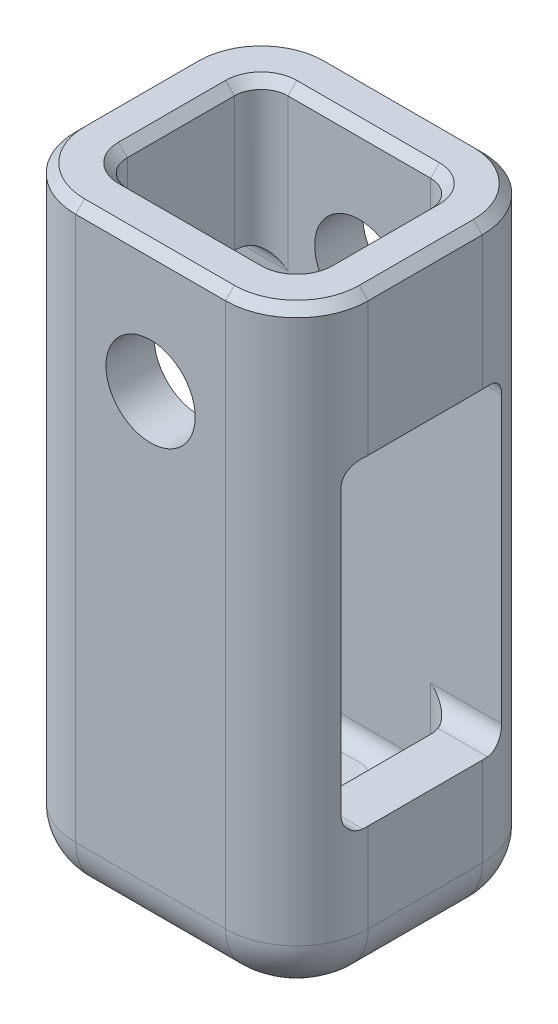
from build123d import *

# Parameters (mm, degrees)
SKETCH1_W                 = 8.2
SKETCH1_H                 = 7.2
BOSS_EXTRUDE1_DEPTH       = 8.5
SKETCH2_W                 = 0.25
SKETCH2_H                 = 0.25
SKETCH2_H_2               = 4
SKETCH2_W_2               = 5
CHAIN_DEPTH               = 15
F_2_5_MM_DOWEL_DEPTH      = 11.100495037
F_2_5_MM_DOWEL_DEPTH_BACK = 11.100495037
SKETCH3_R                 = 1.25
SKETCH4_R                 = 0.9
STEEL_CABLE_CHANNEL_DEPTH = 11.100495037
CRIMP_WINDOW_DEPTH        = 11.100495037
CRIMP_WINDOW_DEPTH_BACK   = 11.100495037
SKETCH7_W                 = 4.5
SKETCH7_H                 = 9
FILLET6_R                 = 0.75
FILLET7_R                 = 0.5
FILLET9_R                 = 0.5
FILLET3_R                 = 2
FILLET5_R                 = 1.5
CHAMFER1_SIZE             = 0.25
BOSS_EXTRUDE2_START       = 0.005
SKETCH5_R                 = 1.9
SKETCH5_R_2               = 0.9
BOSS_EXTRUDE2_DEPTH       = 0.005


with BuildPart() as part:
    # Sketch1 → Boss-Extrude1 (new, symmetric)
    with BuildSketch(Plane(origin=(0, 0, 0), x_dir=(1, 0, 0), z_dir=(0, 1, 0))):
        Rectangle(SKETCH1_W, SKETCH1_H)
    extrude(amount=BOSS_EXTRUDE1_DEPTH, both=True)

    # Sketch2 → chain (cut)
    with BuildSketch(Plane(origin=(0, 8.5, 0), x_dir=(1, 0, 0), z_dir=(0, 1, 0))):
        with Locations((-2.625, 2.125)):
            Rectangle(SKETCH2_W, SKETCH2_H)
        with Locations((-2.625, 0)):
            Rectangle(SKETCH2_W, SKETCH2_H_2)
        with Locations((0, 2.125)):
            Rectangle(SKETCH2_W_2, SKETCH2_H)
        Rectangle(SKETCH2_W_2, SKETCH2_H_2)
        with Locations((2.625, 2.125)):
            Rectangle(SKETCH2_W, SKETCH2_H)
        with Locations((2.625, 0)):
            Rectangle(SKETCH2_W, SKETCH2_H_2)
        with Locations((2.625, -2.125)):
            Rectangle(SKETCH2_W, SKETCH2_H)
        with Locations((0, -2.125)):
            Rectangle(SKETCH2_W_2, SKETCH2_H)
        with Locations((-2.625, -2.125)):
            Rectangle(SKETCH2_W, SKETCH2_H)
    extrude(amount=-CHAIN_DEPTH, mode=Mode.SUBTRACT)

    # Sketch3 → 2.5 mm dowel (cut, two sides: drawn at the far end of the back side and taken through both)
    with BuildSketch(Plane.XY.offset(-F_2_5_MM_DOWEL_DEPTH_BACK)):
        with Locations((0, 5)):
            Circle(SKETCH3_R)
    extrude(amount=F_2_5_MM_DOWEL_DEPTH + F_2_5_MM_DOWEL_DEPTH_BACK, mode=Mode.SUBTRACT)

    # Sketch4 → steel cable channel (cut, through all)
    with BuildSketch(Plane(origin=(0, 0, 0), x_dir=(1, 0, 0), z_dir=(0, 1, 0))):
        with Locations(Location((0, 0, 0), (0, 0, 270))):
            Circle(SKETCH4_R)
    extrude(amount=-STEEL_CABLE_CHANNEL_DEPTH, mode=Mode.SUBTRACT)

    # Sketch7 → crimp window (cut, two sides: drawn at the far end of the back side and taken through both)
    with BuildSketch(Plane.ZY.offset(-CRIMP_WINDOW_DEPTH_BACK)):
        Rectangle(SKETCH7_W, SKETCH7_H)
    extrude(amount=CRIMP_WINDOW_DEPTH + CRIMP_WINDOW_DEPTH_BACK, mode=Mode.SUBTRACT)

    # Fillet6
    fillet6_edges = [part.edges().sort_by_distance(p)[0] for p in [
        (-2.75, -5.5, -2.25),
        (2.75, -5.5, -2.25),
        (2.75, -5.5, 2.25),
        (-2.75, -5.5, 2.25),
        (-2.75, 6.5, -2.25),
        (-2.75, 6.5, 2.25),
        (2.75, 6.5, 2.25),
        (2.75, 6.5, -2.25),
    ]]
    fillet(fillet6_edges, radius=FILLET6_R)

    # Fillet7
    fillet7_edges = [part.edges().sort_by_distance(p)[0] for p in [
        (2.75, -6.5, 0),
        (2.530330086, -6.5, -2.030330086),
        (2.530330086, -6.5, 2.030330086),
        (-2.530330086, -6.5, 2.030330086),
        (-2.530330086, -6.5, -2.030330086),
        (0, -6.5, -2.25),
        (0, -6.5, 2.25),
        (-2.75, -6.5, 0),
    ]]
    fillet(fillet7_edges, radius=FILLET7_R)

    # Fillet9
    fillet9_edges = [part.edges().sort_by_distance(p)[0] for p in [
        (3.05, 4.5, -2.25),
        (3.05, -4.5, 2.25),
        (3.05, 4.5, 2.25),
        (-3.05, 4.5, 2.25),
        (3.05, -4.5, -2.25),
        (-3.05, -4.5, -2.25),
        (-3.05, 4.5, -2.25),
        (-3.05, -4.5, 2.25),
    ]]
    fillet(fillet9_edges, radius=FILLET9_R)

    # Fillet3
    # the kernel refuses this fillet: 2 mm, written as the material it takes off along each edge
    with BuildSketch(Plane(origin=(-4.1, 13.5, -3.6), x_dir=(1, 0, 0), z_dir=(0, -1, 0)), Plane(origin=(4.1, -13.5, -3.6), x_dir=(-1, 0, 0), z_dir=(0, 1, 0))) as fillet3_piece_1:
        with BuildLine():
            CenterArc((FILLET3_R, FILLET3_R), FILLET3_R, 180, 90)
            Line((0, FILLET3_R), (0, 0))
            Line((0, 0), (FILLET3_R, 0))
        make_face()
    extrude(amount=27, mode=Mode.SUBTRACT)
    with BuildSketch(Plane(origin=(-4.1, 13.5, 3.6), x_dir=(1, 0, 0), z_dir=(0, -1, 0)), Plane(origin=(4.1, -13.5, 3.6), x_dir=(-1, 0, 0), z_dir=(0, 1, 0))) as fillet3_piece_2:
        with BuildLine():
            CenterArc((FILLET3_R, -FILLET3_R), FILLET3_R, 90, 90)
            Line((0, -FILLET3_R), (0, 0))
            Line((0, 0), (FILLET3_R, 0))
        make_face()
    extrude(amount=27, mode=Mode.SUBTRACT)

    # Fillet5
    fillet5_edges = [part.edges().sort_by_distance(p)[0] for p in [
        (-4.1, -8.5, 0),
        (4.1, -8.5, 0),
        (0, -8.5, 3.6),
        (0, -8.5, -3.6),
        (3.514213562, -8.5, 3.014213562),
        (3.514213562, -8.5, -3.014213562),
        (-3.514213562, -8.5, 3.014213562),
        (-3.514213562, -8.5, -3.014213562),
    ]]
    fillet(fillet5_edges, radius=FILLET5_R)

    # Chamfer1
    chamfer1_edges = [part.edges().sort_by_distance(p)[0] for p in [
        (2.530330086, 8.5, -2.030330086),
        (-2.530330086, 8.5, -2.030330086),
        (2.530330086, 8.5, 2.030330086),
        (-2.530330086, 8.5, 2.030330086),
        (-4.1, 8.5, 0),
        (0, 8.5, -3.6),
        (4.1, 8.5, 0),
        (0, 8.5, 3.6),
        (3.514213562, 8.5, 3.014213562),
        (3.514213562, 8.5, -3.014213562),
        (-3.514213562, 8.5, 3.014213562),
        (-3.514213562, 8.5, -3.014213562),
        (0, 8.5, -2.25),
        (2.75, 8.5, 0),
        (-2.75, 8.5, 0),
        (0, 8.5, 2.25),
    ]]
    chamfer(chamfer1_edges, length=CHAMFER1_SIZE)

    # Sketch5 → Boss-Extrude2 (add)
    with BuildSketch(Plane(origin=(0, -6.5, 0), x_dir=(1, 0, 0), z_dir=(0, 1, 0)).offset(BOSS_EXTRUDE2_START)):
        Circle(SKETCH5_R)
        with Locations(Location((0, 0, 0), (0, 0, 270))):
            Circle(SKETCH5_R_2, mode=Mode.SUBTRACT)
    extrude(amount=-BOSS_EXTRUDE2_DEPTH)


solid = part.part
